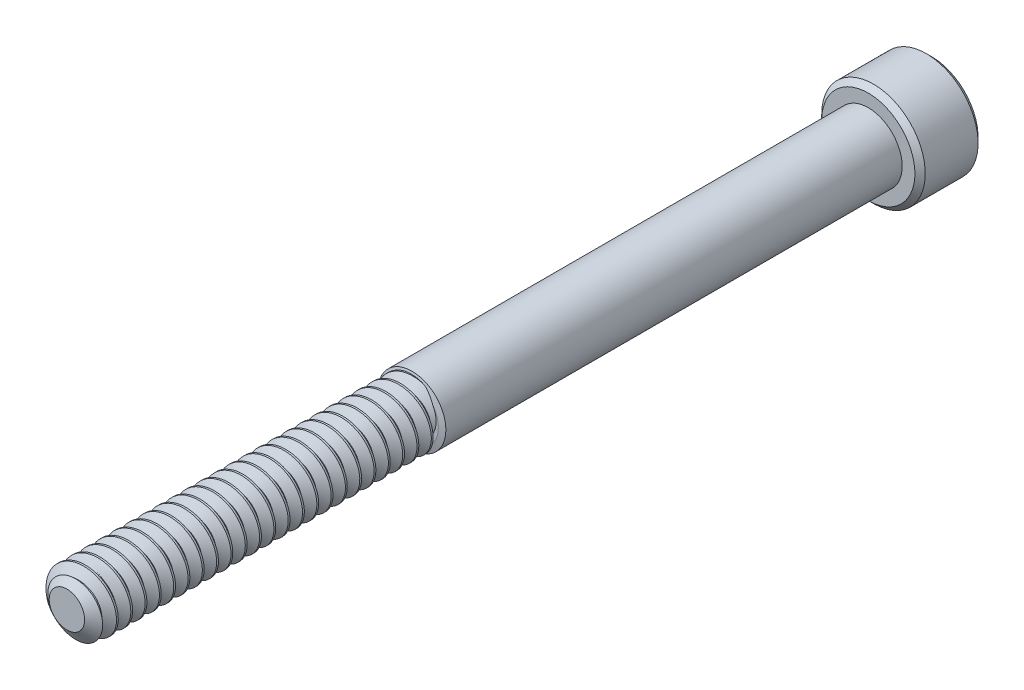
from build123d import *

# Parameters (mm, degrees)
SKETCH1_R          = 1.7526
EXTRUDE1_DEPTH     = 44.45
CUT_SWEEP1_PITCH   = 0.79375
SKETCH6_R          = 2.8702
EXTRUDE2_DEPTH     = 3.5052
CUT_EXTRUDE1_DEPTH = 2.08359375
CHAMFER1_SIZE      = 0.28702


with BuildPart() as part:
    # Sketch1 → Extrude1 (new body)
    with BuildSketch(Plane.XY):
        Circle(SKETCH1_R)
    extrude(amount=-EXTRUDE1_DEPTH)

    # Cut-Sweep1: the profile of Sketch3 profile screwed along a right-hand helix of 57 turns, 6 arcs to a turn; built about Z, then put on its axis
    cut_sweep1_z = Axis((0, 0, 0), (0, 0, 1))
    cut_sweep1_corners = [(1.7529, 0, -0.694704455), (1.237044252, 0, -0.396875), (1.237044252, 0, -0.29765625), (1.7529, 0, 0.000173205)]
    with BuildLine(mode=Mode.PRIVATE) as cut_sweep1_profile:
        Line(cut_sweep1_corners[0], cut_sweep1_corners[1])
        Line(cut_sweep1_corners[1], cut_sweep1_corners[2])
        Line(cut_sweep1_corners[2], cut_sweep1_corners[3])
        Line(cut_sweep1_corners[3], cut_sweep1_corners[0])
    cut_sweep1_cap = Face(cut_sweep1_profile.wire())
    cut_sweep1_turn_angles = [0, 30, 60, 90, 120, 150, 180, 210, 240, 270, 300, 330, 360, 390, 420, 450, 480, 510, 540, 570, 600, 630, 660, 690, 720]
    cut_sweep1_turn_weights = [1, 0.8660254037844387, 1, 0.8660254037844387, 1, 0.8660254037844387, 1, 0.8660254037844387, 1, 0.8660254037844387, 1, 0.8660254037844387, 1, 0.8660254037844387, 1, 0.8660254037844387, 1, 0.8660254037844387, 1, 0.8660254037844387, 1, 0.8660254037844387, 1, 0.8660254037844387, 1]
    cut_sweep1_turn_rails = [Edge.make_bspline([Vector(p[0], p[1], 0).rotate(cut_sweep1_z, cut_sweep1_turn_angles[k]) / cut_sweep1_turn_weights[k] + Vector(0, 0, p[2] + CUT_SWEEP1_PITCH * cut_sweep1_turn_angles[k] / 360) for k in range(25)], [0, 0, 0, 1, 1, 2, 2, 3, 3, 4, 4, 5, 5, 6, 6, 7, 7, 8, 8, 9, 9, 10, 10, 11, 11, 12, 12, 12], 2, cut_sweep1_turn_weights) for p in cut_sweep1_corners]
    cut_sweep1_turn_sides = [Face.make_surface_from_curves(cut_sweep1_turn_rails[p[0]], cut_sweep1_turn_rails[p[1]]) for p in [(0, 1), (1, 2), (2, 3), (3, 0)]]
    cut_sweep1_last_angles = [20160, 20190, 20220, 20250, 20280, 20310, 20340, 20370, 20400, 20430, 20460, 20490, 20519.999999999]
    cut_sweep1_last_weights = [1, 0.8660254037844387, 1, 0.8660254037844387, 1, 0.8660254037844387, 1, 0.8660254037844387, 1, 0.8660254037844387, 1, 0.8660254037873752, 1]
    cut_sweep1_last_rails = [Edge.make_bspline([Vector(p[0], p[1], 0).rotate(cut_sweep1_z, cut_sweep1_last_angles[k]) / cut_sweep1_last_weights[k] + Vector(0, 0, p[2] + CUT_SWEEP1_PITCH * cut_sweep1_last_angles[k] / 360) for k in range(13)], [0, 0, 0, 1, 1, 2, 2, 3, 3, 4, 4, 5, 5, 6, 6, 6], 2, cut_sweep1_last_weights) for p in cut_sweep1_corners]
    cut_sweep1_last_sides = [Face.make_surface_from_curves(cut_sweep1_last_rails[p[0]], cut_sweep1_last_rails[p[1]]) for p in [(0, 1), (1, 2), (2, 3), (3, 0)]]
    cut_sweep1 = Plane(origin=(0, 0, 0), x_dir=(0, 1, 0), z_dir=(0, 0, -1)) * Solid(Shell([*[p.moved(Location((0, 0, 2 * CUT_SWEEP1_PITCH * i))) for i in range(28) for p in cut_sweep1_turn_sides], *cut_sweep1_last_sides, cut_sweep1_cap, cut_sweep1_cap.rotate(cut_sweep1_z, 20519.999999999).moved(Location((0, 0, CUT_SWEEP1_PITCH * 20519.999999999 / 360)))]))
    add(cut_sweep1, mode=Mode.SUBTRACT)

    # Sketch4 → Cut-Revolve1 (revolve, cut)
    with BuildSketch(Plane(origin=(0, 0, 0), x_dir=(0, 0, -1), z_dir=(1, 0, 0)), mode=Mode.PRIVATE) as cut_revolve1_sk:
        Polygon((0.538848736, 1.7526), (0, 0.983044252), (0, 1.7526), align=None)
    revolve(cut_revolve1_sk.sketch.rotate(Axis((0, 0, 0), (0, 0, -1)), 262.136702753), axis=Axis((0, 0, 0), (0, 0, -1)), mode=Mode.SUBTRACT)

    # Sketch5 → partially thread (revolve)
    with BuildSketch(Plane(origin=(0, 0, 0), x_dir=(0, 0, -1), z_dir=(1, 0, 0)), mode=Mode.PRIVATE) as partially_thread_sk:
        Polygon((44.45, 1.8796), (19.138476823, 1.8796), (19.05, 1.5494), (19.05, 0), (44.45, 0), align=None)
    revolve(partially_thread_sk.sketch.rotate(Axis((0, 0, 0), (0, 0, -1)), 262.136702753), axis=Axis((0, 0, 0), (0, 0, -1)))

    # Sketch6 → Extrude2 (add)
    with BuildSketch(Plane(origin=(0, 0, -44.45), x_dir=(-1, 0, 0), z_dir=(0, 0, -1))):
        Circle(SKETCH6_R)
    extrude(amount=EXTRUDE2_DEPTH)

    # Sketch7 → Cut-Extrude1 (cut)
    with BuildSketch(Plane(origin=(0, 0, -47.9552), x_dir=(-1, 0, 0), z_dir=(0, 0, -1))):
        Polygon((0, 1.603951217), (-1.3890625, 0.801975608), (-1.3890625, -0.801975608), (0, -1.603951217), (1.3890625, -0.801975608), (1.3890625, 0.801975608), align=None)
    extrude(amount=-CUT_EXTRUDE1_DEPTH, mode=Mode.SUBTRACT)

    # Cut-Extrude2 cone 1 section (through the dimple's axis) → Cut-Extrude2 (revolve, cut)
    with BuildSketch(Plane(origin=(0, 0, -47.9552), x_dir=(0, 1, 0), z_dir=(1, 0, 0))):
        Polygon((0, 0), (1.603951217, 0), (0, 1.603951217), align=None)
    revolve(axis=Axis((0, 0, -47.9552), (0, 0, 1)), mode=Mode.SUBTRACT)

    # Chamfer1
    chamfer1_edges = [part.edges().sort_by_distance(p)[0] for p in [
        (2.8702, 0, -44.45),
        (2.8702, 0, -47.9552),
    ]]
    chamfer(chamfer1_edges, length=CHAMFER1_SIZE)


solid = part.part
